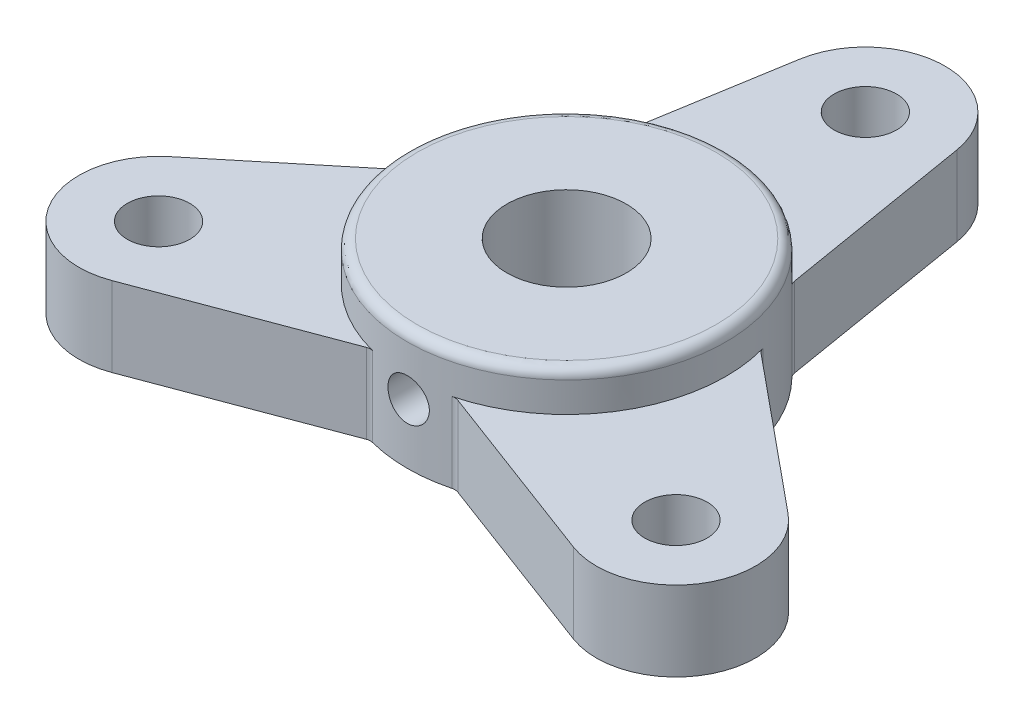
from build123d import *

# Parameters (mm, degrees)
SKETCH1_R                        = 12.7
SKETCH1_R_2                      = 4.7625
BOSS_EXTRUDE1_DEPTH              = 6.35
BOSS_EXTRUDE2_START              = 3.175
SKETCH1_5_R                      = 12.7
SKETCH1_5_R_2                    = 4.7625
BOSS_EXTRUDE2_DEPTH              = 3.175
F_10_CLEARANCE_HOLE1_D           = 4.9784
TAP_DRILL_FOR_M4X0_7_TAP1_REACH  = 52.866
TAP_DRILL_FOR_M4X0_7_TAP1_BORE_R = 1.65
FILLET1_R                        = 0.79375


with BuildPart() as part:
    # Sketch1 → Boss-Extrude1 (new body)
    # profile 1 of 4: a face of its own
    with BuildSketch(Plane(origin=(0, 0, 0), x_dir=(1, 0, 0), z_dir=(0, 1, 0))):
        with BuildLine():
            ThreePointArc((6.263906023, 24.854604283), (0, 30.1625), (-6.263906023, 24.854604283))
            Line((-6.263906023, 24.854604283), (-8.89, 9.069614104))
            ThreePointArc((-8.89, 9.069614104), (0, 12.7), (8.89, 9.069614104))
            Line((8.89, 9.069614104), (6.263906023, 24.854604283))
        make_face()
    # profile 2 of 4: a face of its own
    with BuildSketch(Plane(origin=(0, 0, 0), x_dir=(1, 0, 0), z_dir=(0, 1, 0))):
        Circle(SKETCH1_R)
        with Locations(Location((0, 0, 0), (0, 0, 270))):
            Circle(SKETCH1_R_2, mode=Mode.SUBTRACT)
    # profile 3 of 4: a face of its own
    with BuildSketch(Plane(origin=(0, 0, 0), x_dir=(1, 0, 0), z_dir=(0, 1, 0))):
        with BuildLine():
            Line((24.656671722, -7.002600399), (12.299516217, 3.164158788))
            ThreePointArc((12.299516217, 3.164158788), (12.599481258, 1.594701233), (12.7, 0))
            ThreePointArc((12.7, 0), (10.114120228, -7.680792409), (3.409516217, -12.233772892))
            Line((3.409516217, -12.233772892), (18.392765699, -17.852003884))
            ThreePointArc((18.392765699, -17.852003884), (26.121491242, -15.08125), (24.656671722, -7.002600399))
        make_face()
    # profile 4 of 4: a face of its own
    with BuildSketch(Plane(origin=(0, 0, 0), x_dir=(1, 0, 0), z_dir=(0, 1, 0))):
        with BuildLine():
            ThreePointArc((-3.409516217, -12.233772892), (-10.998522628, -6.35), (-12.299516217, 3.164158788))
            Line((-12.299516217, 3.164158788), (-24.656671722, -7.002600399))
            ThreePointArc((-24.656671722, -7.002600399), (-26.121491242, -15.08125), (-18.392765699, -17.852003884))
            Line((-18.392765699, -17.852003884), (-3.409516217, -12.233772892))
        make_face()
    extrude(amount=-BOSS_EXTRUDE1_DEPTH)

    # Sketch1<5> → Boss-Extrude2 (add)
    with BuildSketch(Plane(origin=(0, 0, 0), x_dir=(1, 0, 0), z_dir=(0, 1, 0)).offset(BOSS_EXTRUDE2_START)):
        with Locations(Location((0, 0, 0), (0, 0, 270))):
            Circle(SKETCH1_5_R)
        with Locations(Location((0, 0, 0), (0, 0, 270))):
            Circle(SKETCH1_5_R_2, mode=Mode.SUBTRACT)
    extrude(amount=-BOSS_EXTRUDE2_DEPTH)

    # #10 Clearance Hole1 (through all)
    with Locations(Plane(origin=(0, 0, -23.8125), x_dir=(0, 0, 1), z_dir=(0, 1, 0))):
        with Locations((0, 0), (35.71875, 20.622229928), (35.71875, -20.622229928)):
            Hole(F_10_CLEARANCE_HOLE1_D / 2)

    # Tap Drill for M4x0.7 Tap1 bore (on position points) → Tap Drill for M4x0.7 Tap1 (cut, up to next)
    with BuildSketch(Plane(origin=(0, -1.5875, 12.7), x_dir=(1, 0, 0), z_dir=(0, 0, 1)), mode=Mode.PRIVATE) as tap_drill_for_m4x0_7_tap1_sk1:
        Circle(TAP_DRILL_FOR_M4X0_7_TAP1_BORE_R)
    tap_drill_for_m4x0_7_tap1_tool1 = extrude(tap_drill_for_m4x0_7_tap1_sk1.sketch, amount=-TAP_DRILL_FOR_M4X0_7_TAP1_REACH, mode=Mode.PRIVATE) & part.part
    add(tap_drill_for_m4x0_7_tap1_tool1.solids().sort_by_distance((0, -1.5875, 12.7))[0], mode=Mode.SUBTRACT)

    # Fillet1
    # the kernel refuses this fillet: 0.79375 mm, written as the material it adds along each edge
    with BuildSketch(Plane(origin=(8.89, 0, -9.069614104), x_dir=(0.7073032764952122, 0, 0.7069102312593428), z_dir=(0, -1, 0)), Plane(origin=(3.409516217, 0, 12.233772892), x_dir=(-0.9658538567133282, 0, 0.2590874899951552), z_dir=(0, -1, 0)), Plane(origin=(-12.299516217, 0, -3.164158788), x_dir=(0.2585505802181169, 0, -0.965997721254494), z_dir=(0, -1, 0))) as fillet1_piece_1:
        with BuildLine():
            CenterArc((0.254671056, -0.793712483), FILLET1_R, 90.557072072, 35.013262483)
            Line((-0.207054828, -0.148074604), (0, 0))
            ThreePointArc((0, 0), (0.123476876, -0.000600272), (0.246953752, 0))
        make_face()
    extrude(amount=6.35)
    with BuildSketch(Plane(origin=(12.299516217, 0, -3.164158788), x_dir=(-0.2585505802181021, 0, -0.9659977212544979), z_dir=(0, -1, 0)), Plane(origin=(-3.409516217, 0, 12.233772892), x_dir=(0.9658538567133268, 0, 0.2590874899951606), z_dir=(0, -1, 0)), Plane(origin=(-8.89, 0, -9.069614104), x_dir=(-0.7073032764952193, 0, 0.7069102312593356), z_dir=(0, -1, 0))) as fillet1_piece_2:
        with BuildLine():
            CenterArc((0.254671056, 0.793712483), FILLET1_R, 234.429665445, 35.013262483)
            Line((-0.207054828, 0.148074604), (0, 0))
            ThreePointArc((0, 0), (0.123476876, 0.000600272), (0.246953752, 0))
        make_face()
    extrude(amount=6.35)
    # the kernel refuses this fillet: 0.79375 mm, written as the material it takes off along each edge
    with BuildSketch(Plane(origin=(0, 3.175, 0), x_dir=(0, 0, 1), z_dir=(-1, 0, 0))) as fillet1_2_piece_1:
        with BuildLine():
            CenterArc((12.7 - FILLET1_R, -FILLET1_R), FILLET1_R, 0, 90)
            Line((12.7, -FILLET1_R), (12.7, 0))
            Line((12.7, 0), (12.7 - FILLET1_R, 0))
        make_face()
    revolve(axis=Axis((0, 3.175, 0), (0, 1, 0)), mode=Mode.SUBTRACT)


solid = part.part
